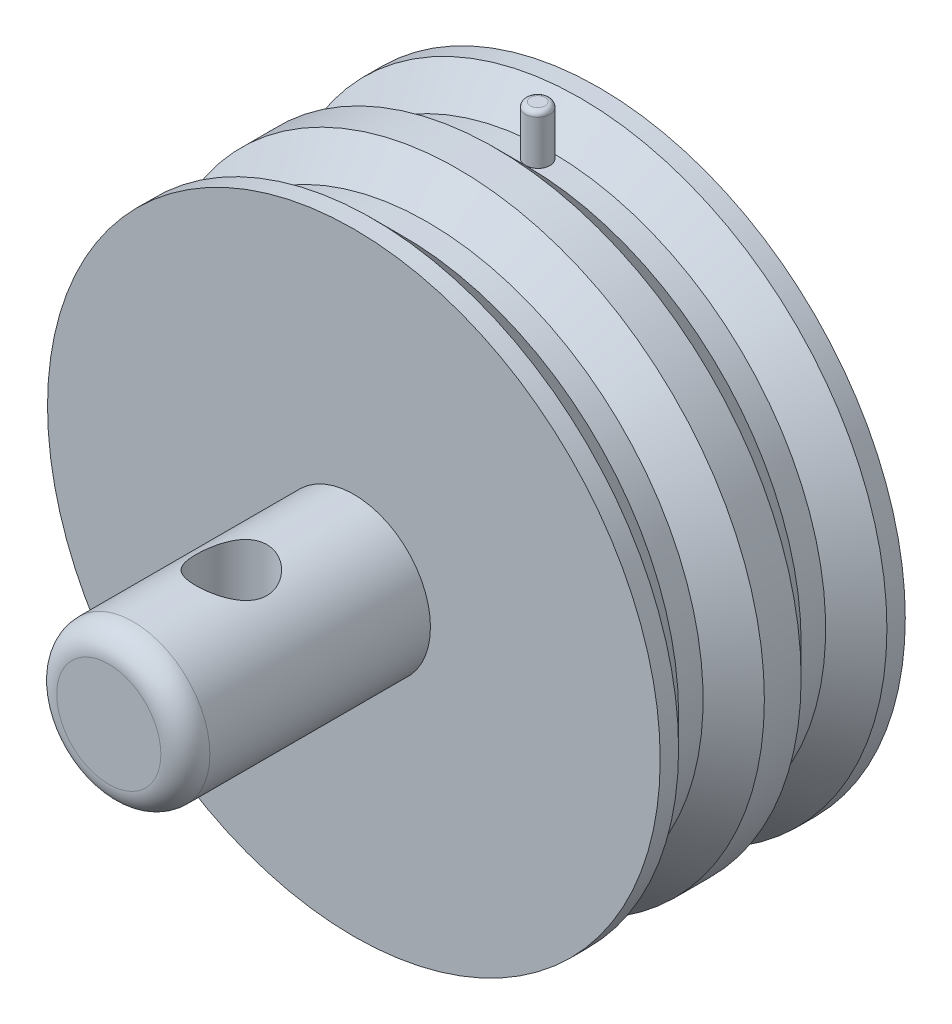
from build123d import *

# Parameters (mm, degrees)
ESQUISSE1_R                  = 3.125
BOSS_EXTRU_1_DEPTH           = 10
CONG_1_R                     = 1
ESQUISSE2_R                  = 12.5
BOSS_EXTRU_3_DEPTH           = 10
ENL_V_MAT_EXTRU_1_DEPTH      = 21.310096012
ENL_V_MAT_EXTRU_1_DEPTH_BACK = 21.310096012
ESQUISSE6_R                  = 1.45
BOSS_EXTRU_4_DEPTH           = 2
BOSS_EXTRU_4_DEPTH_BACK      = 1
ESQUISSE7_R                  = 0.5
BOSS_EXTRU_5_DEPTH           = 2
BOSS_EXTRU_5_DEPTH_BACK      = 1
ESQUISSE8_R                  = 0.5
CONG_2_R                     = 0.2


with BuildPart() as part:
    # Esquisse1 → Boss.-Extru.1 (new body)
    with BuildSketch(Plane.XY):
        Circle(ESQUISSE1_R)
    extrude(amount=BOSS_EXTRU_1_DEPTH)

    # Congé1
    cong_1_edges = [part.edges().sort_by_distance(p)[0] for p in [
        (-3.125, 0, 10),
    ]]
    fillet(cong_1_edges, radius=CONG_1_R)

    # Esquisse2 → Boss.-Extru.3 (add)
    with BuildSketch(Plane(origin=(0, 0, 0), x_dir=(-1, 0, 0), z_dir=(0, 0, -1))):
        Circle(ESQUISSE2_R)
    extrude(amount=BOSS_EXTRU_3_DEPTH)

    # Esquisse5 → Enlèvement de matière-Révolution1 (revolve, cut)
    with BuildSketch(Plane(origin=(0, 0, 0), x_dir=(0, 0, -1), z_dir=(1, 0, 0))):
        Polygon((0.75, 12.5), (2, 11.25), (3, 11.25), (4.25, 12.5), align=None)
        Polygon((5.75, 12.5), (9.25, 12.5), (8, 11.25), (7, 11.25), align=None)
    revolve(axis=Axis((0, 0, 0), (0, 0, -1)), mode=Mode.SUBTRACT)

    # Esquisse6 → Enlèv. mat.-Extru.1 (cut, two sides: drawn at the far end of the back side and taken through both)
    with BuildSketch(Plane(origin=(0, 0, 0), x_dir=(1, 0, 0), z_dir=(0, 1, 0)).offset(-ENL_V_MAT_EXTRU_1_DEPTH_BACK)):
        with Locations((0, -5)):
            Circle(ESQUISSE6_R)
    extrude(amount=ENL_V_MAT_EXTRU_1_DEPTH + ENL_V_MAT_EXTRU_1_DEPTH_BACK, mode=Mode.SUBTRACT)

    # Esquisse7 → Boss.-Extru.4 (add, two sides: drawn at the far end of the back side and taken through both)
    with BuildSketch(Plane(origin=(0, 11.25, 0), x_dir=(1, 0, 0), z_dir=(0, 1, 0)).offset(-BOSS_EXTRU_4_DEPTH_BACK)):
        with Locations((0, 7.5)):
            Circle(ESQUISSE7_R)
    extrude(amount=BOSS_EXTRU_4_DEPTH + BOSS_EXTRU_4_DEPTH_BACK)

    # Esquisse8 → Boss.-Extru.5 (add, two sides: drawn at the far end of the back side and taken through both)
    with BuildSketch(Plane(origin=(0, -11.25, 0), x_dir=(-1, 0, 0), z_dir=(0, -1, 0)).offset(-BOSS_EXTRU_5_DEPTH_BACK)):
        with Locations((0, 2.5)):
            Circle(ESQUISSE8_R)
    extrude(amount=BOSS_EXTRU_5_DEPTH + BOSS_EXTRU_5_DEPTH_BACK)

    # Congé2
    cong_2_edges = [part.edges().sort_by_distance(p)[0] for p in [
        (-0.5, 13.25, -7.5),
        (0.5, -13.25, -2.5),
    ]]
    fillet(cong_2_edges, radius=CONG_2_R)


solid = part.part
